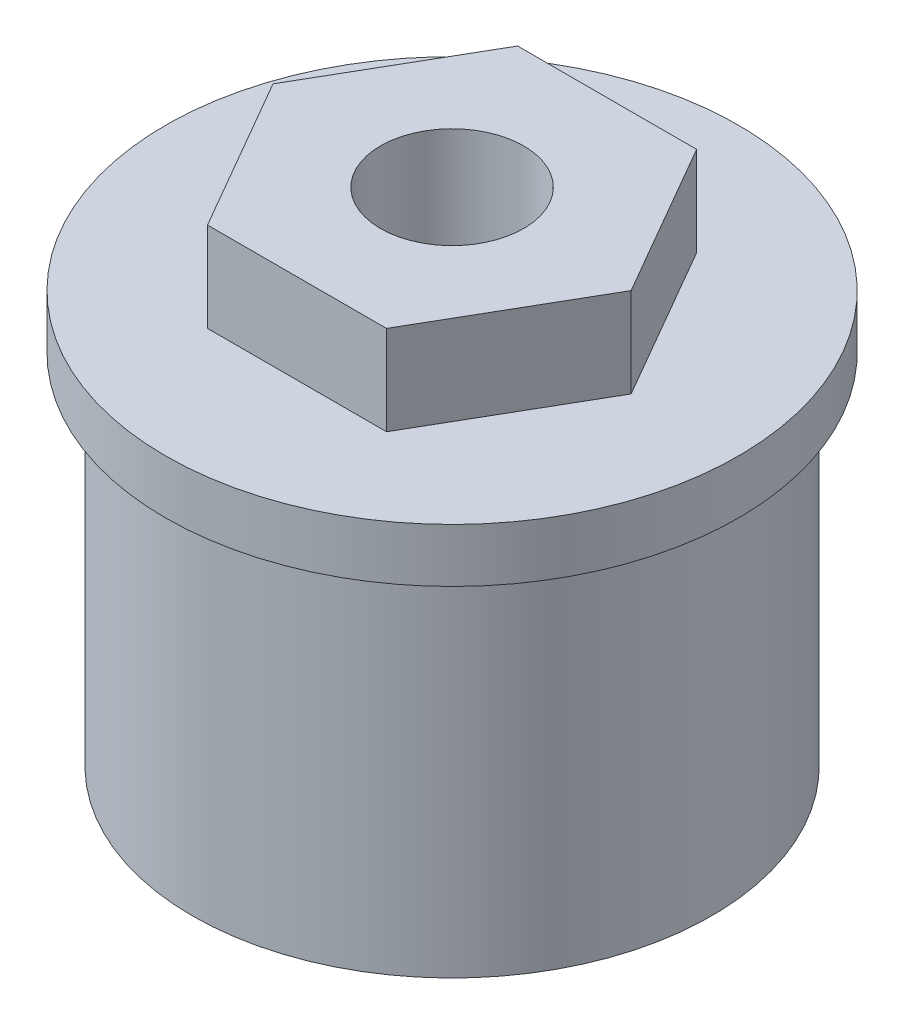
from build123d import *

# Parameters (mm, degrees)
SKETCH1_R           = 14.5
BOSS_EXTRUDE1_DEPTH = 20
SKETCH2_R           = 16
BOSS_EXTRUDE2_DEPTH = 3
BOSS_EXTRUDE3_DEPTH = 5
SKETCH4_R           = 4
CUT_EXTRUDE1_DEPTH  = 30


with BuildPart() as part:
    # Sketch1 → Boss-Extrude1 (new body)
    with BuildSketch(Plane(origin=(0, 0, 0), x_dir=(1, 0, 0), z_dir=(0, 1, 0))):
        Circle(SKETCH1_R)
    extrude(amount=BOSS_EXTRUDE1_DEPTH)

    # Sketch2 → Boss-Extrude2 (add)
    with BuildSketch(Plane(origin=(0, 20, 0), x_dir=(1, 0, 0), z_dir=(0, 1, 0))):
        Circle(SKETCH2_R)
    extrude(amount=BOSS_EXTRUDE2_DEPTH)

    # Sketch3 → Boss-Extrude3 (add)
    with BuildSketch(Plane(origin=(0, 23, 0), x_dir=(1, 0, 0), z_dir=(0, 1, 0))):
        Polygon((10, 0), (5, 8.660254038), (-5, 8.660254038), (-10, 0), (-5, -8.660254038), (5, -8.660254038), align=None)
    extrude(amount=BOSS_EXTRUDE3_DEPTH)

    # Sketch4 → Cut-Extrude1 (cut)
    with BuildSketch(Plane(origin=(0, 28, 0), x_dir=(1, 0, 0), z_dir=(0, 1, 0))):
        Circle(SKETCH4_R)
    extrude(amount=-CUT_EXTRUDE1_DEPTH, mode=Mode.SUBTRACT)


solid = part.part
